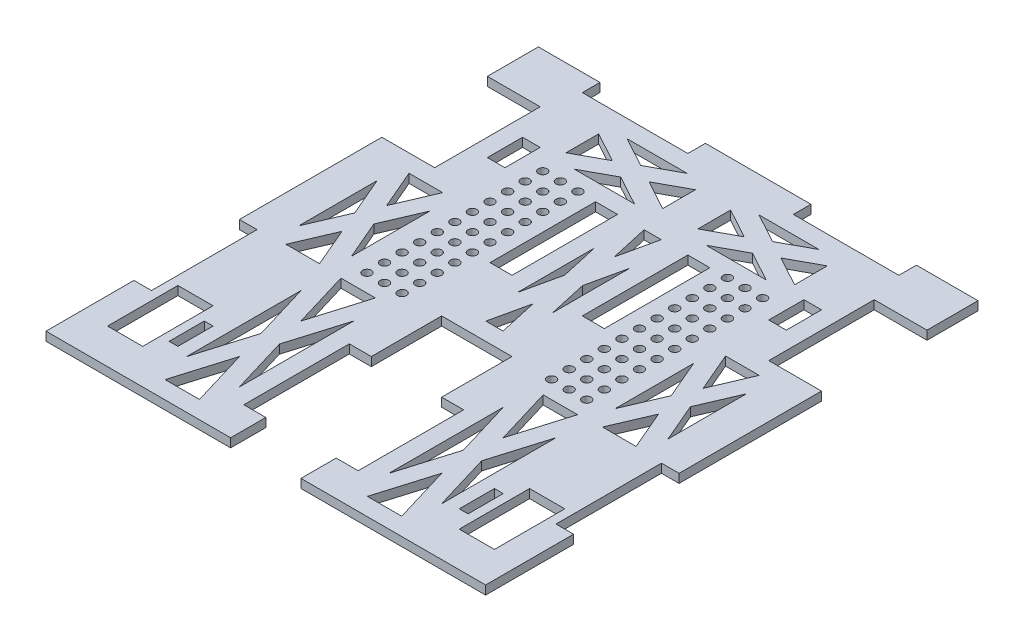
from build123d import *

# Parameters (mm, degrees)
SKETCH1_W           = 317.5
SKETCH1_H           = 355.6
BOSS_EXTRUDE1_DEPTH = 6.35
SKETCH2_W           = 50.8
SKETCH2_H           = 152.4
CUT_EXTRUDE1_DEPTH  = 239.442288615
SKETCH3_W           = 25.4
SKETCH3_H           = 76.2
SKETCH3_W_2         = 12.7
SKETCH3_H_2         = 25.4
CUT_EXTRUDE2_DEPTH  = 239.442288615
SKETCH4_W           = 12.7
SKETCH4_H           = 76.2
SKETCH4_W_2         = 76.2
SKETCH4_H_2         = 12.7
SKETCH4_W_3         = 15.875
CUT_EXTRUDE3_DEPTH  = 239.442288615
SKETCH5_W           = 25.4
SKETCH5_H           = 50.8
SKETCH5_W_2         = 6.35
SKETCH5_H_2         = 25.4
CUT_EXTRUDE4_DEPTH  = 239.442288615
SKETCH7_R           = 3.175
CUT_EXTRUDE6_DEPTH  = 239.442288615


with BuildPart() as part:
    # Sketch1 → Boss-Extrude1 (new body)
    with BuildSketch(Plane(origin=(0, 0, 0), x_dir=(1, 0, 0), z_dir=(0, 1, 0))):
        Rectangle(SKETCH1_W, SKETCH1_H)
    extrude(amount=BOSS_EXTRUDE1_DEPTH)

    # Sketch2 → Cut-Extrude1 (cut, through all)
    with BuildSketch(Plane(origin=(0, 6.35, 0), x_dir=(1, 0, 0), z_dir=(0, 1, 0))):
        with Locations((0, -101.6)):
            Rectangle(SKETCH2_W, SKETCH2_H)
    extrude(amount=-CUT_EXTRUDE1_DEPTH, mode=Mode.SUBTRACT)

    # Sketch3 → Cut-Extrude2 (cut, through all)
    with BuildSketch(Plane(origin=(0, 6.35, 0), x_dir=(1, 0, 0), z_dir=(0, 1, 0))):
        with Locations((133.35, 102.87)):
            Rectangle(SKETCH3_W, SKETCH3_H)
        with Locations((101.6, 102.87)):
            Rectangle(SKETCH3_W_2, SKETCH3_H_2)
        with Locations((-101.6, 102.87)):
            Rectangle(SKETCH3_W_2, SKETCH3_H_2)
        with Locations((-133.35, 102.87)):
            Rectangle(SKETCH3_W, SKETCH3_H)
    extrude(amount=-CUT_EXTRUDE2_DEPTH, mode=Mode.SUBTRACT)

    # Sketch4 → Cut-Extrude3 (cut, through all)
    with BuildSketch(Plane(origin=(0, 6.35, 0), x_dir=(1, 0, 0), z_dir=(0, 1, 0))):
        with Locations((-152.4, 102.87)):
            Rectangle(SKETCH4_W, SKETCH4_H)
        with Locations((-152.4, -76.2)):
            Rectangle(SKETCH4_W, SKETCH4_H)
        with Locations((152.4, 102.87)):
            Rectangle(SKETCH4_W, SKETCH4_H)
        with Locations((152.4, -76.2)):
            Rectangle(SKETCH4_W, SKETCH4_H)
        with Locations((76.2, 171.45)):
            Rectangle(SKETCH4_W_2, SKETCH4_H_2)
        with Locations((-76.2, 171.45)):
            Rectangle(SKETCH4_W_2, SKETCH4_H_2)
        with Locations((-33.3375, -114.3)):
            Rectangle(SKETCH4_W_3, SKETCH4_H)
        with Locations((33.3375, 63.5)):
            Rectangle(SKETCH4_W_3, SKETCH4_H)
        with Locations((-33.3375, 63.5)):
            Rectangle(SKETCH4_W_3, SKETCH4_H)
        with Locations((33.3375, -114.3)):
            Rectangle(SKETCH4_W_3, SKETCH4_H)
    extrude(amount=-CUT_EXTRUDE3_DEPTH, mode=Mode.SUBTRACT)

    # Sketch5 → Cut-Extrude4 (cut, through all)
    with BuildSketch(Plane(origin=(0, 6.35, 0), x_dir=(1, 0, 0), z_dir=(0, 1, 0))):
        Polygon((-73.025, -123.698648777), (-85.445405367, -165.1), (-60.604594633, -165.1), align=None)
        Polygon((-92.075, -60.198648777), (-92.075, -143.001351223), (-79.654594633, -101.6), align=None)
        Polygon((-53.975, -60.198648777), (-66.395405367, -101.6), (-53.975, -143.001351223), align=None)
        Polygon((-85.445405367, -38.1), (-73.025, -79.501351223), (-60.604594633, -38.1), align=None)
        Polygon((-114.3, -8.500053074), (-126.441405825, -36.83), (-102.158594175, -36.83), align=None)
        Polygon((-133.35, 35.949946926), (-133.35, -20.709946926), (-121.208594175, 7.62), align=None)
        Polygon((-95.25, 35.949946926), (-107.391405825, 7.62), (-95.25, -20.709946926), align=None)
        Polygon((-126.441405825, 52.07), (-114.3, 23.740053074), (-102.158594175, 52.07), align=None)
        Polygon((-47.625, 126.116793459), (-69.289121342, 114.3), (-25.960878658, 114.3), align=None)
        Polygon((-82.55, 145.166793459), (-82.55, 121.533206541), (-60.885878658, 133.35), align=None)
        Polygon((-12.7, 145.166793459), (-34.364121342, 133.35), (-12.7, 121.533206541), align=None)
        Polygon((-69.289121342, 152.4), (-47.625, 140.583206541), (-25.960878658, 152.4), align=None)
        Polygon((0, 15.177946348), (-6.195099188, -12.7), (6.195099188, -12.7), align=None)
        Polygon((-12.7, 72.327946348), (-12.7, 16.572053652), (-6.504900812, 44.45), align=None)
        Polygon((12.7, 72.327946348), (6.504900812, 44.45), (12.7, 16.572053652), align=None)
        Polygon((-6.195099188, 101.6), (0, 73.722053652), (6.195099188, 101.6), align=None)
        with Locations((-127, -127)):
            Rectangle(SKETCH5_W, SKETCH5_H)
        with Locations((-104.775, -127)):
            Rectangle(SKETCH5_W_2, SKETCH5_H_2)
    cut_extrude4 = extrude(amount=-CUT_EXTRUDE4_DEPTH, mode=Mode.SUBTRACT)

    # Mirror1: Cut-Extrude4 across plane
    add(cut_extrude4.mirror(Plane(origin=(0, 0, 0), x_dir=(0, 0, 1), z_dir=(1, 0, 0))), mode=Mode.SUBTRACT)

    # Sketch7 → Cut-Extrude6 (cut, through all)
    with BuildSketch(Plane(origin=(0, 6.35, 0), x_dir=(1, 0, 0), z_dir=(0, 1, 0))):
        with Locations((53.975, 101.6)):
            Circle(SKETCH7_R)
        with Locations((66.675, 101.6)):
            Circle(SKETCH7_R)
        with Locations((79.375, 101.6)):
            Circle(SKETCH7_R)
        with Locations((66.675, 88.9)):
            Circle(SKETCH7_R)
        with Locations((79.375, 88.9)):
            Circle(SKETCH7_R)
        with Locations((66.675, 76.2)):
            Circle(SKETCH7_R)
        with Locations((79.375, 76.2)):
            Circle(SKETCH7_R)
        with Locations((66.675, 63.5)):
            Circle(SKETCH7_R)
        with Locations((79.375, 63.5)):
            Circle(SKETCH7_R)
        with Locations((66.675, 50.8)):
            Circle(SKETCH7_R)
        with Locations((79.375, 50.8)):
            Circle(SKETCH7_R)
        with Locations((66.675, 38.1)):
            Circle(SKETCH7_R)
        with Locations((79.375, 38.1)):
            Circle(SKETCH7_R)
        with Locations((66.675, 25.4)):
            Circle(SKETCH7_R)
        with Locations((79.375, 25.4)):
            Circle(SKETCH7_R)
        with Locations((66.675, 12.7)):
            Circle(SKETCH7_R)
        with Locations((79.375, 12.7)):
            Circle(SKETCH7_R)
        with Locations((66.675, 0)):
            Circle(SKETCH7_R)
        with Locations((79.375, 0)):
            Circle(SKETCH7_R)
        with Locations((66.675, -12.7)):
            Circle(SKETCH7_R)
        with Locations((79.375, -12.7)):
            Circle(SKETCH7_R)
        with Locations((66.675, -25.4)):
            Circle(SKETCH7_R)
        with Locations((79.375, -25.4)):
            Circle(SKETCH7_R)
        with Locations((53.975, 88.9)):
            Circle(SKETCH7_R)
        with Locations((53.975, 76.2)):
            Circle(SKETCH7_R)
        with Locations((53.975, 63.5)):
            Circle(SKETCH7_R)
        with Locations((53.975, 50.8)):
            Circle(SKETCH7_R)
        with Locations((53.975, 38.1)):
            Circle(SKETCH7_R)
        with Locations((53.975, 25.4)):
            Circle(SKETCH7_R)
        with Locations((53.975, 12.7)):
            Circle(SKETCH7_R)
        with Locations((53.975, 0)):
            Circle(SKETCH7_R)
        with Locations((53.975, -12.7)):
            Circle(SKETCH7_R)
        with Locations((53.975, -25.4)):
            Circle(SKETCH7_R)
        with Locations((-53.975, -25.4)):
            Circle(SKETCH7_R)
        with Locations((-53.975, -12.7)):
            Circle(SKETCH7_R)
        with Locations((-53.975, 0)):
            Circle(SKETCH7_R)
        with Locations((-53.975, 12.7)):
            Circle(SKETCH7_R)
        with Locations((-53.975, 25.4)):
            Circle(SKETCH7_R)
        with Locations((-53.975, 38.1)):
            Circle(SKETCH7_R)
        with Locations((-53.975, 50.8)):
            Circle(SKETCH7_R)
        with Locations((-53.975, 63.5)):
            Circle(SKETCH7_R)
        with Locations((-53.975, 76.2)):
            Circle(SKETCH7_R)
        with Locations((-53.975, 88.9)):
            Circle(SKETCH7_R)
        with Locations((-79.375, -25.4)):
            Circle(SKETCH7_R)
        with Locations((-66.675, -25.4)):
            Circle(SKETCH7_R)
        with Locations((-79.375, -12.7)):
            Circle(SKETCH7_R)
        with Locations((-66.675, -12.7)):
            Circle(SKETCH7_R)
        with Locations((-79.375, 0)):
            Circle(SKETCH7_R)
        with Locations((-66.675, 0)):
            Circle(SKETCH7_R)
        with Locations((-79.375, 12.7)):
            Circle(SKETCH7_R)
        with Locations((-66.675, 12.7)):
            Circle(SKETCH7_R)
        with Locations((-79.375, 25.4)):
            Circle(SKETCH7_R)
        with Locations((-66.675, 25.4)):
            Circle(SKETCH7_R)
        with Locations((-79.375, 38.1)):
            Circle(SKETCH7_R)
        with Locations((-66.675, 38.1)):
            Circle(SKETCH7_R)
        with Locations((-79.375, 50.8)):
            Circle(SKETCH7_R)
        with Locations((-66.675, 50.8)):
            Circle(SKETCH7_R)
        with Locations((-79.375, 63.5)):
            Circle(SKETCH7_R)
        with Locations((-66.675, 63.5)):
            Circle(SKETCH7_R)
        with Locations((-79.375, 76.2)):
            Circle(SKETCH7_R)
        with Locations((-66.675, 76.2)):
            Circle(SKETCH7_R)
        with Locations((-79.375, 88.9)):
            Circle(SKETCH7_R)
        with Locations((-66.675, 88.9)):
            Circle(SKETCH7_R)
        with Locations((-79.375, 101.6)):
            Circle(SKETCH7_R)
        with Locations((-66.675, 101.6)):
            Circle(SKETCH7_R)
        with Locations((-53.975, 101.6)):
            Circle(SKETCH7_R)
    extrude(amount=-CUT_EXTRUDE6_DEPTH, mode=Mode.SUBTRACT)


solid = part.part
